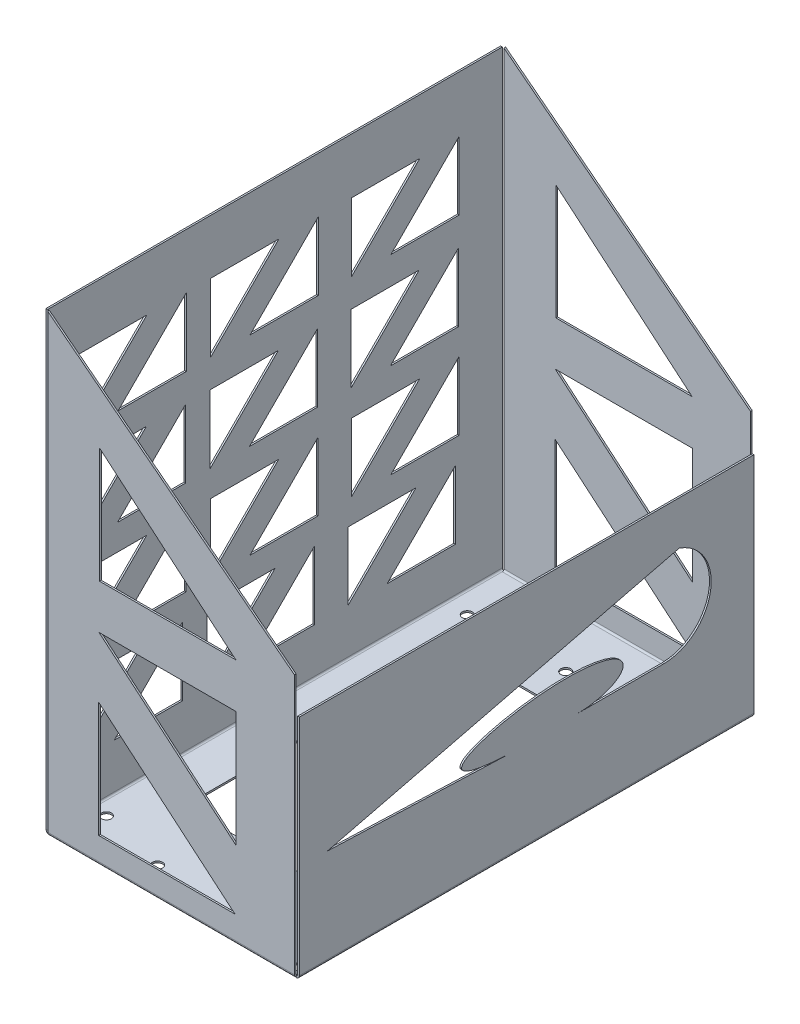
from build123d import *

# Parameters (mm, degrees)
SKETCH1_W                    = 110
SKETCH1_H                    = 200
SKETCH1_W_2                  = 70
SKETCH1_H_2                  = 120
BASE_FLANGE1_DEPTH           = 0.7366
EDGE_FLANGE1_STRIP_W         = 4.4196
EDGE_FLANGE1_STRIP_H         = 0.7366
EDGE_FLANGE1_STRIP_CUT_DEPTH = 200
EDGE_FLANGE1_DEPTH           = 200
EDGE_FLANGE2_STRIP_W         = 4.4196
EDGE_FLANGE2_STRIP_H         = 0.7366
EDGE_FLANGE2_STRIP_CUT_DEPTH = 200
EDGE_FLANGE2_DEPTH           = 200
EDGE_FLANGE3_STRIP_W         = 4.4196
EDGE_FLANGE3_STRIP_H         = 0.7366
EDGE_FLANGE3_STRIP_CUT_DEPTH = 108.5268
EDGE_FLANGE3_DEPTH           = 108.5268
EDGE_FLANGE3_START           = 0.7366
EDGE_FLANGE3_FLAT_DEPTH      = 0.7366
EDGE_FLANGE4_STRIP_W         = 4.4196
EDGE_FLANGE4_STRIP_H         = 0.7366
EDGE_FLANGE4_STRIP_CUT_DEPTH = 108.5268
EDGE_FLANGE4_DEPTH           = 108.5268
EDGE_FLANGE4_START           = 0.7366
EDGE_FLANGE4_FLAT_DEPTH      = 0.7366
CUT_EXTRUDE2_DEPTH           = 289.797370967
CUT_EXTRUDE3_START           = -0.7366
CUT_EXTRUDE3_DEPTH           = 0.7366
CUT_EXTRUDE4_DEPTH           = 10
CUT_EXTRUDE6_DEPTH           = 800.082459726
CUT_EXTRUDE6_DEPTH_BACK      = 800.082459726
SKETCH53_R                   = 2.2
SKETCH53_R_2                 = 2.199999998


# Read off the part's stored shape, not the designer's step: Cut-Extrude3
# Sheet-metal steps are written as plain solids
with BuildPart() as part:
    # Sketch1 → Base-Flange1 (new body)
    with BuildSketch(Plane(origin=(0, 0, 0), x_dir=(1, 0, 0), z_dir=(0, 1, 0))):
        Rectangle(SKETCH1_W, SKETCH1_H)
        Rectangle(SKETCH1_W_2, SKETCH1_H_2, mode=Mode.SUBTRACT)
    extrude(amount=-BASE_FLANGE1_DEPTH)

    # Edge-Flange1 strip (across the edge) → Edge-Flange1 strip cut (cut)
    with BuildSketch(Plane(origin=(-55, 0, -100), x_dir=(1, 0, 0), z_dir=(0, 0, 1))):
        with Locations((-1.4732, -0.3683)):
            Rectangle(EDGE_FLANGE1_STRIP_W, EDGE_FLANGE1_STRIP_H)
    extrude(amount=EDGE_FLANGE1_STRIP_CUT_DEPTH, mode=Mode.SUBTRACT)

    # Edge-Flange1 section (across the edge) → Edge-Flange1 (add)
    with BuildSketch(Plane(origin=(-55, 0, -100), x_dir=(1, 0, 0), z_dir=(0, 0, 1))):
        with BuildLine():
            Line((-0.7366, 0.7366), (-0.7366, 199.2634))
            Line((-0.7366, 199.2634), (0, 199.2634))
            Line((0, 199.2634), (0, 0.7366))
            ThreePointArc((0, 0.7366), (0.215745145, 0.215745145), (0.7366, 0))
            Line((0.7366, 0), (0.7366, -0.7366))
            ThreePointArc((0.7366, -0.7366), (-0.30510971, -0.30510971), (-0.7366, 0.7366))
        make_face()
    extrude(amount=EDGE_FLANGE1_DEPTH)

    # Edge-Flange2 strip (across the edge) → Edge-Flange2 strip cut (cut)
    with BuildSketch(Plane(origin=(55, 0, 100), x_dir=(-1, 0, 0), z_dir=(0, 0, -1))):
        with Locations((-1.4732, -0.3683)):
            Rectangle(EDGE_FLANGE2_STRIP_W, EDGE_FLANGE2_STRIP_H)
    extrude(amount=EDGE_FLANGE2_STRIP_CUT_DEPTH, mode=Mode.SUBTRACT)

    # Edge-Flange2 section (across the edge) → Edge-Flange2 (add)
    with BuildSketch(Plane(origin=(55, 0, 100), x_dir=(-1, 0, 0), z_dir=(0, 0, -1))):
        with BuildLine():
            Line((-0.7366, 0.7366), (-0.7366, 99.2634))
            Line((-0.7366, 99.2634), (0, 99.2634))
            Line((0, 99.2634), (0, 0.7366))
            ThreePointArc((0, 0.7366), (0.215745145, 0.215745145), (0.7366, 0))
            Line((0.7366, 0), (0.7366, -0.7366))
            ThreePointArc((0.7366, -0.7366), (-0.30510971, -0.30510971), (-0.7366, 0.7366))
        make_face()
    extrude(amount=EDGE_FLANGE2_DEPTH)

    # Edge-Flange3 strip (across the edge) → Edge-Flange3 strip cut (cut)
    with BuildSketch(Plane(origin=(54.2634, 0, -100), x_dir=(0, 0, 1), z_dir=(-1, 0, 0))):
        with Locations((-1.4732, -0.3683)):
            Rectangle(EDGE_FLANGE3_STRIP_W, EDGE_FLANGE3_STRIP_H)
    extrude(amount=EDGE_FLANGE3_STRIP_CUT_DEPTH, mode=Mode.SUBTRACT)

    # Edge-Flange3 bend section (across the edge) → Edge-Flange3 (add)
    with BuildSketch(Plane(origin=(54.2634, 0, -100), x_dir=(0, 0, 1), z_dir=(-1, 0, 0))):
        with BuildLine():
            Line((-0.7366, 0.7366), (0, 0.7366))
            ThreePointArc((0, 0.7366), (0.215745145, 0.215745145), (0.7366, 0))
            Line((0.7366, 0), (0.7366, -0.7366))
            ThreePointArc((0.7366, -0.7366), (-0.30510971, -0.30510971), (-0.7366, 0.7366))
        make_face()
    extrude(amount=EDGE_FLANGE3_DEPTH)

    # Edge-Flange3 profile (on flange) → Edge-Flange3 flat (add)
    with BuildSketch(Plane(origin=(0, 0, -100), x_dir=(-1, 0, 0), z_dir=(0, 0, -1)).offset(EDGE_FLANGE3_START)):
        Polygon((-54.2634, 115), (-54.2634, 0.7366), (54.2634, 0.7366), (54.2634, 199.2634), align=None)
    extrude(amount=-EDGE_FLANGE3_FLAT_DEPTH)

    # Edge-Flange4 strip (across the edge) → Edge-Flange4 strip cut (cut)
    with BuildSketch(Plane(origin=(-54.2634, 0, 100), x_dir=(0, 0, -1), z_dir=(1, 0, 0))):
        with Locations((-1.4732, -0.3683)):
            Rectangle(EDGE_FLANGE4_STRIP_W, EDGE_FLANGE4_STRIP_H)
    extrude(amount=EDGE_FLANGE4_STRIP_CUT_DEPTH, mode=Mode.SUBTRACT)

    # Edge-Flange4 bend section (across the edge) → Edge-Flange4 (add)
    with BuildSketch(Plane(origin=(-54.2634, 0, 100), x_dir=(0, 0, -1), z_dir=(1, 0, 0))):
        with BuildLine():
            Line((-0.7366, 0.7366), (0, 0.7366))
            ThreePointArc((0, 0.7366), (0.215745145, 0.215745145), (0.7366, 0))
            Line((0.7366, 0), (0.7366, -0.7366))
            ThreePointArc((0.7366, -0.7366), (-0.30510971, -0.30510971), (-0.7366, 0.7366))
        make_face()
    extrude(amount=EDGE_FLANGE4_DEPTH)

    # Edge-Flange4 profile (on flange) → Edge-Flange4 flat (add)
    with BuildSketch(Plane.XY.offset(100).offset(EDGE_FLANGE4_START)):
        Polygon((-54.2634, 199.2634), (-54.2634, 0.7366), (54.2634, 0.7366), (54.2634, 115), align=None)
    extrude(amount=-EDGE_FLANGE4_FLAT_DEPTH)

    # Sketch24 → Cut-Extrude2 (cut, through all)
    with BuildSketch(Plane(origin=(0, 0, -100.7366), x_dir=(-1, 0, 0), z_dir=(0, 0, -1))):
        Polygon((-28.519875042, 107.808063094), (31.460124178, 107.808063094), (31.460124178, 158.533542729), align=None)
        Polygon((-28.150641863, 10.732953924), (31.829357358, 10.732953924), (31.829357358, 61.45843356), align=None)
        Polygon((31.713150602, 88.173102361), (-28.636081798, 88.173102361), (-28.636081798, 37.135359798), align=None)
    extrude(amount=-CUT_EXTRUDE2_DEPTH, mode=Mode.SUBTRACT)

    # Cut-Extrude3 outline → Cut-Extrude3 (cut)
    with BuildSketch(Plane(origin=(55.7366, 0, 0), x_dir=(0, 0, -1), z_dir=(1, 0, 0)).offset(CUT_EXTRUDE3_START)):
        with BuildLine():
            Line((-87.713422796, 42.053472661), (-6.797155753, 39.040000774))
            add(Edge.make_bspline(
                [(-6.797155753, 39.040000774), (-87.713422796, 42.053472661), (67.110125935, 80.068334048), (60.312641059, 39.424036929), (22.052524279, 39.424036929)],
                knots=[0, 0, 0, 0, 0, 1, 1, 1, 1, 1], degree=4))
            Line((22.052524279, 39.424036929), (60.312641059, 39.424036929))
            ThreePointArc((60.312641059, 39.424036929), (80.917037974, 56.86865569), (67.110125935, 80.068334048))
            Line((67.110125935, 80.068334048), (-87.713422796, 42.053472661))
        make_face()
    extrude(amount=CUT_EXTRUDE3_DEPTH, mode=Mode.SUBTRACT)

    # Sketch27 → Cut-Extrude4 (cut)
    with BuildSketch(Plane.ZY.offset(55.7366)):
        Polygon((-81.030674839, 174.694529505), (-51.030674839, 144.694529505), (-81.030674839, 144.694529505), align=None)
        Polygon((-63.70727906, 174.919469028), (-33.70727906, 144.919469028), (-33.70727906, 174.919469028), align=None)
        Polygon((-19.044962813, 175.025529764), (10.955037187, 145.025529764), (-19.044962813, 145.025529764), align=None)
        Polygon((-1.721567034, 175.250469287), (28.278432966, 145.250469287), (28.278432966, 175.250469287), align=None)
        Polygon((39.049915779, 175.115451878), (69.049915779, 145.115451878), (39.049915779, 145.115451878), align=None)
        Polygon((56.373311558, 175.340391401), (86.373311558, 145.340391401), (86.373311558, 175.340391401), align=None)
        Polygon((-80.758012165, 132.319744393), (-50.758012165, 102.319744393), (-80.758012165, 102.319744393), align=None)
        Polygon((-63.434616386, 132.544683916), (-33.434616386, 102.544683916), (-33.434616386, 132.544683916), align=None)
        Polygon((-18.77230014, 132.650744652), (11.22769986, 102.650744652), (-18.77230014, 102.650744652), align=None)
        Polygon((-1.44890436, 132.875684175), (28.55109564, 102.875684175), (28.55109564, 132.875684175), align=None)
        Polygon((39.322578452, 132.740666766), (69.322578452, 102.740666766), (39.322578452, 102.740666766), align=None)
        Polygon((56.645974232, 132.965606289), (86.645974232, 102.965606289), (86.645974232, 132.965606289), align=None)
        Polygon((-80.939093152, 90.751483468), (-50.939093152, 60.751483468), (-80.939093152, 60.751483468), align=None)
        Polygon((-63.615697372, 90.976422991), (-33.615697372, 60.976422991), (-33.615697372, 90.976422991), align=None)
        Polygon((-18.953381126, 91.082483727), (11.046618874, 61.082483727), (-18.953381126, 61.082483727), align=None)
        Polygon((-1.629985347, 91.30742325), (28.370014653, 61.30742325), (28.370014653, 91.30742325), align=None)
        Polygon((39.141497466, 91.172405841), (69.141497466, 61.172405841), (39.141497466, 61.172405841), align=None)
        Polygon((56.464893245, 91.397345364), (86.464893245, 61.397345364), (86.464893245, 91.397345364), align=None)
        Polygon((-79.353506577, 50.050530958), (-49.353506577, 20.050530958), (-79.353506577, 20.050530958), align=None)
        Polygon((-62.030110797, 50.275470481), (-32.030110797, 20.275470481), (-32.030110797, 50.275470481), align=None)
        Polygon((-17.367794551, 50.381531217), (12.632205449, 20.381531217), (-17.367794551, 20.381531217), align=None)
        Polygon((-0.044398772, 50.60647074), (29.955601228, 20.60647074), (29.955601228, 50.60647074), align=None)
        Polygon((40.727084041, 50.47145333), (70.727084041, 20.47145333), (40.727084041, 20.47145333), align=None)
        Polygon((58.05047982, 50.696392853), (88.05047982, 20.696392853), (88.05047982, 50.696392853), align=None)
    extrude(amount=-CUT_EXTRUDE4_DEPTH, mode=Mode.SUBTRACT)

    # Sketch53 → Cut-Extrude6 (cut, two sides: drawn at the far end of the back side and taken through both)
    with BuildSketch(Plane(origin=(344.115063699, 0, 561.793038506), x_dir=(-1, 0, 0), z_dir=(0, 1, 0)).offset(-CUT_EXTRUDE6_DEPTH_BACK)):
        with Locations(Location((392.463649434, -480.956438506, 0), (0, 0, 90))):
            Circle(SKETCH53_R)
        with Locations(Location((392.463649434, -465.956438506, 0), (0, 0, 90))):
            Circle(SKETCH53_R)
        with Locations(Location((362.463649434, -473.456438506, 0), (0, 0, 90))):
            Circle(SKETCH53_R)
        with Locations(Location((292.463649434, -480.956438506, 0), (0, 0, 90))):
            Circle(SKETCH53_R)
        with Locations(Location((292.463649434, -465.956438506, 0), (0, 0, 90))):
            Circle(SKETCH53_R)
        with Locations(Location((322.463649434, -473.456438506, 0), (0, 0, 90))):
            Circle(SKETCH53_R)
        with Locations(Location((294.03158687, -636.983238506, 0), (0, 0, 90))):
            Circle(SKETCH53_R_2)
        with Locations(Location((324.69158687, -646.983238506, 0), (0, 0, 90))):
            Circle(SKETCH53_R_2)
        with Locations(Location((346.36158687, -636.983238506, 0), (0, 0, 90))):
            Circle(SKETCH53_R_2)
        with Locations(Location((368.028253537, -646.983238506, 0), (0, 0, 90))):
            Circle(SKETCH53_R_2)
        with Locations(Location((389.694920203, -636.983238506, 0), (0, 0, 90))):
            Circle(SKETCH53_R_2)
    extrude(amount=CUT_EXTRUDE6_DEPTH + CUT_EXTRUDE6_DEPTH_BACK, mode=Mode.SUBTRACT)


solid = part.part
